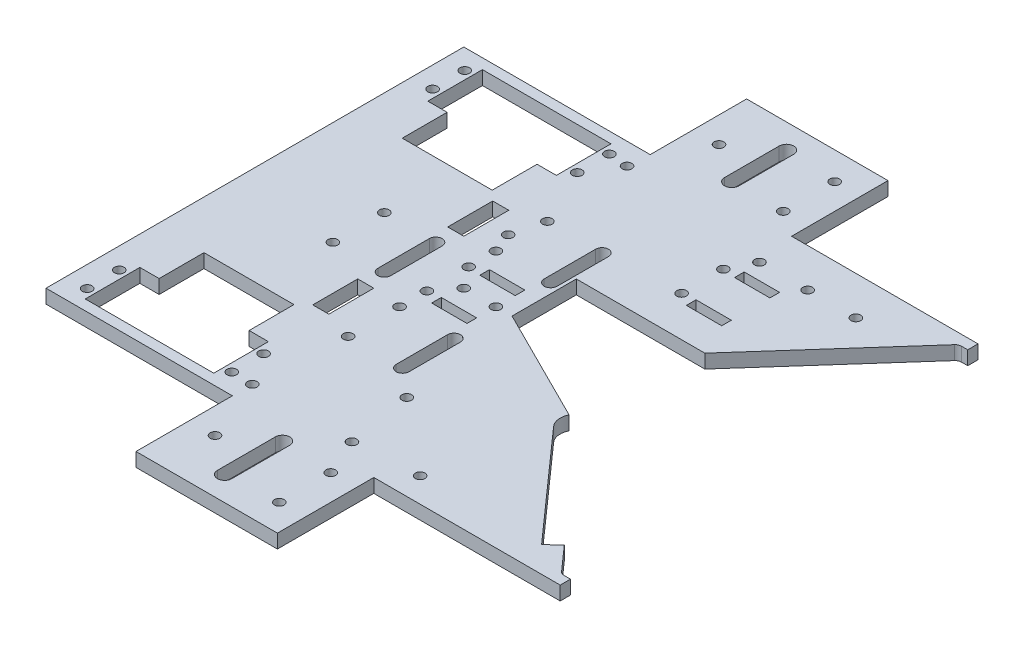
from build123d import *

# Parameters (mm, degrees)
BOSS_EXTRUDE1_DEPTH = 4.3
CUT_EXTRUDE1_DEPTH  = 4.5
FILLET1_R           = 2
CUT_EXTRUDE2_DEPTH  = 10
SKETCH8_R           = 1.5
CUT_EXTRUDE3_DEPTH  = 10
SKETCH9_R           = 1.5
CUT_EXTRUDE4_DEPTH  = 10
CUT_EXTRUDE5_DEPTH  = 10
SKETCH11_R          = 1.5
CUT_EXTRUDE6_DEPTH  = 10
SKETCH12_R          = 1.5
CUT_EXTRUDE7_DEPTH  = 10
SKETCH7_R           = 1.5
SKETCH7_W           = 11
SKETCH7_H           = 3
CUT_EXTRUDE8_DEPTH  = 9
SKETCH13_R          = 1.5
CUT_EXTRUDE9_DEPTH  = 10
SKETCH14_R          = 1.5
CUT_EXTRUDE10_DEPTH = 10
SKETCH15_W          = 5
SKETCH15_H          = 14
CUT_EXTRUDE11_DEPTH = 10
SKETCH16_R          = 1.5
CUT_EXTRUDE12_DEPTH = 10
SKETCH18_R          = 1.5
CUT_EXTRUDE13_DEPTH = 10


with BuildPart() as part:
    # Sketch2 → Boss-Extrude1 (new body)
    with BuildSketch(Plane(origin=(0, 0, 0), x_dir=(1, 0, 0), z_dir=(0, 1, 0))):
        Polygon((0, 0), (0, 65), (58, 65), (58, 95), (102, 95), (102, 65), (160, 65), (160, 0), align=None)
    extrude(amount=BOSS_EXTRUDE1_DEPTH)

    # Mirror1: part across plane


with BuildPart() as part_1:
    add(part.part)
    add(part.part.mirror(Plane(origin=(0, 4.3, 0), x_dir=(1, 0, 0), z_dir=(0, 0, -1))))

    # Sketch3 → Cut-Extrude1 (cut)
    with BuildSketch(Plane(origin=(0, 4.3, 0), x_dir=(1, 0, 0), z_dir=(0, 1, 0))):
        Polygon((160, -61.8), (160, 61.8), (157.156451185, 61.8), (120.012594795, 20), (80.012594795, 20), (80.012594795, 0), (120, -20), (157.155555556, -61.8), align=None)
    extrude(amount=-CUT_EXTRUDE1_DEPTH, mode=Mode.SUBTRACT)

    # Fillet1
    fillet1_edges = [part_1.edges().sort_by_distance(p)[0] for p in [
        (157.156451185, 2.15, -61.8),
        (157.155555556, 2.15, 61.8),
    ]]
    fillet(fillet1_edges, radius=FILLET1_R)

    # Sketch6 → Cut-Extrude2 (cut)
    with BuildSketch(Plane(origin=(0, 4.3, 0), x_dir=(1, 0, 0), z_dir=(0, 1, 0))):
        Polygon((9, -61.8), (49, -61.8), (49, -44.8), (43, -44.8), (43, -30.841820122), (15, -30.841820122), (15, -44.8), (9, -44.8), align=None)
        Polygon((9, 44.8), (15, 44.8), (15, 30.841820122), (43, 30.841820122), (43, 44.8), (49, 44.8), (49, 61.8), (9, 61.8), align=None)
    extrude(amount=-CUT_EXTRUDE2_DEPTH, mode=Mode.SUBTRACT)

    # Sketch8 → Cut-Extrude3 (cut)
    with BuildSketch(Plane(origin=(0, 4.3, 0), x_dir=(1, 0, 0), z_dir=(0, 1, 0))):
        with Locations((6.5, 58.8)):
            Circle(SKETCH8_R)
        with Locations((6.5, 48.8)):
            Circle(SKETCH8_R)
        with Locations((51.5, 48.8)):
            Circle(SKETCH8_R)
        with Locations((51.5, 58.8)):
            Circle(SKETCH8_R)
        with Locations((6.5, -48.7)):
            Circle(SKETCH8_R)
        with Locations((6.5, -58.7)):
            Circle(SKETCH8_R)
        with Locations((51.5, -58.7)):
            Circle(SKETCH8_R)
        with Locations((51.5, -48.8)):
            Circle(SKETCH8_R)
    extrude(amount=-CUT_EXTRUDE3_DEPTH, mode=Mode.SUBTRACT)

    # Sketch9 → Cut-Extrude4 (cut)
    with BuildSketch(Plane.XZ):
        with Locations((94, 70.4)):
            Circle(SKETCH9_R)
        with Locations((66, 78.4)):
            Circle(SKETCH9_R)
        with Locations((66, -78.4)):
            Circle(SKETCH9_R)
        with Locations((94, -86.4)):
            Circle(SKETCH9_R)
        with Locations((94, 86.4)):
            Circle(SKETCH9_R)
        with Locations((94, -70.4)):
            Circle(SKETCH9_R)
        with BuildLine():
            Line((75.75, 69.4), (75.75, 87.4))
            ThreePointArc((75.75, 87.4), (78, 89.65), (80.25, 87.4))
            Line((80.25, 87.4), (80.25, 69.4))
            ThreePointArc((80.25, 69.4), (78, 67.15), (75.75, 69.4))
        make_face()
        with BuildLine():
            Line((75.75, -87.4), (75.75, -70.4))
            ThreePointArc((75.75, -70.4), (78, -68.15), (80.25, -70.4))
            Line((80.25, -70.4), (80.25, -87.4))
            ThreePointArc((80.25, -87.4), (78, -89.65), (75.75, -87.4))
        make_face()
    extrude(amount=-CUT_EXTRUDE4_DEPTH, mode=Mode.SUBTRACT)

    # Sketch10 → Cut-Extrude5 (cut)
    with BuildSketch(Plane(origin=(0, 4.3, 0), x_dir=(1, 0, 0), z_dir=(0, 1, 0))):
        with BuildLine():
            Line((123.321819194, -23.737046593), (149.896372747, -53.633419341))
            Line((149.896372747, -53.633419341), (146.159326154, -56.955238535))
            Line((146.159326154, -56.955238535), (116.262953407, -23.321819194))
            ThreePointArc((116.262953407, -23.321819194), (120.29361011, -15.008628134), (123.321819194, -23.737046593))
        make_face()
    extrude(amount=-CUT_EXTRUDE5_DEPTH, mode=Mode.SUBTRACT)

    # Sketch11 → Cut-Extrude6 (cut)
    with BuildSketch(Plane.XZ):
        with BuildLine():
            ThreePointArc((79, 31.031280577), (77, 33.031280577), (75, 31.031280577))
            Line((75, 31.031280577), (75, 15.031280577))
            ThreePointArc((75, 15.031280577), (77, 13.031280577), (79, 15.031280577))
            Line((79, 15.031280577), (79, 31.031280577))
        make_face()
        with BuildLine():
            ThreePointArc((75, -31.031280577), (77, -33.031280577), (79, -31.031280577))
            Line((79, -31.031280577), (79, -15.031280577))
            ThreePointArc((79, -15.031280577), (77, -13.031280577), (75, -15.031280577))
            Line((75, -15.031280577), (75, -31.031280577))
        make_face()
        with Locations((60, 31)):
            Circle(SKETCH11_R)
        with Locations((60, 15)):
            Circle(SKETCH11_R)
        with Locations((60, -15)):
            Circle(SKETCH11_R)
        with Locations((60, -31)):
            Circle(SKETCH11_R)
    extrude(amount=-CUT_EXTRUDE6_DEPTH, mode=Mode.SUBTRACT)

    # Sketch12 → Cut-Extrude7 (cut)
    with BuildSketch(Plane(origin=(0, 0, 0), x_dir=(-1, 0, 0), z_dir=(0, -1, 0))):
        with BuildLine():
            ThreePointArc((-50.262723036, -8), (-48.262723036, -10), (-46.262723036, -8))
            Line((-46.262723036, -8), (-46.262723036, 8))
            ThreePointArc((-46.262723036, 8), (-48.262723036, 10), (-50.262723036, 8))
            Line((-50.262723036, 8), (-50.262723036, -8))
        make_face()
        with Locations((-32.262723036, -8)):
            Circle(SKETCH12_R)
        with Locations((-32.262723036, 8)):
            Circle(SKETCH12_R)
    extrude(amount=-CUT_EXTRUDE7_DEPTH, mode=Mode.SUBTRACT)

    # Sketch7 → Cut-Extrude8 (cut)
    with BuildSketch(Plane(origin=(0, 4.3, 0), x_dir=(1, 0, 0), z_dir=(0, 1, 0))):
        with Locations((60.012594795, -6.5)):
            Circle(SKETCH7_R)
        with Locations((60.012594795, 6.5)):
            Circle(SKETCH7_R)
        with Locations((100.267282946, 32.5)):
            Circle(SKETCH7_R)
        with Locations((100.267282946, 45.5)):
            Circle(SKETCH7_R)
        with Locations((69.5, -7.5)):
            Rectangle(SKETCH7_W, SKETCH7_H)
        with Locations((69.5, 7.5)):
            Rectangle(SKETCH7_W, SKETCH7_H)
        with Locations((109.754688151, 31.5)):
            Rectangle(SKETCH7_W, SKETCH7_H)
        with Locations((109.754688151, 46.5)):
            Rectangle(SKETCH7_W, SKETCH7_H)
    extrude(amount=-CUT_EXTRUDE8_DEPTH, mode=Mode.SUBTRACT)

    # Sketch13 → Cut-Extrude9 (cut)
    with BuildSketch(Plane(origin=(0, 4.3, 0), x_dir=(1, 0, 0), z_dir=(0, 1, 0))):
        with Locations((75, 0)):
            Circle(SKETCH13_R)
        with Locations((65, 0)):
            Circle(SKETCH13_R)
    extrude(amount=-CUT_EXTRUDE9_DEPTH, mode=Mode.SUBTRACT)

    # Sketch14 → Cut-Extrude10 (cut)
    with BuildSketch(Plane(origin=(0, 4.3, 0), x_dir=(1, 0, 0), z_dir=(0, 1, 0))):
        with Locations((57.5, 58.3)):
            Circle(SKETCH14_R)
        with Locations((57.5, 21.3)):
            Circle(SKETCH14_R)
        with Locations((85.565271793, -38.309819587)):
            Circle(SKETCH14_R)
        with Locations((108.754116531, -57.343407785)):
            Circle(SKETCH14_R)
    extrude(amount=-CUT_EXTRUDE10_DEPTH, mode=Mode.SUBTRACT)

    # Sketch15 → Cut-Extrude11 (cut)
    with BuildSketch(Plane(origin=(0, 4.3, 0), x_dir=(1, 0, 0), z_dir=(0, 1, 0))):
        with Locations((48.5, 21)):
            Rectangle(SKETCH15_W, SKETCH15_H)
        with Locations((48.5, -21)):
            Rectangle(SKETCH15_W, SKETCH15_H)
    extrude(amount=-CUT_EXTRUDE11_DEPTH, mode=Mode.SUBTRACT)

    # Sketch16 → Cut-Extrude12 (cut)
    with BuildSketch(Plane(origin=(0, 4.3, 0), x_dir=(1, 0, 0), z_dir=(0, 1, 0))):
        with Locations((89, -58.8)):
            Circle(SKETCH16_R)
        with Locations((58, -58.8)):
            Circle(SKETCH16_R)
    extrude(amount=-CUT_EXTRUDE12_DEPTH, mode=Mode.SUBTRACT)

    # Sketch18 → Cut-Extrude13 (cut)
    with BuildSketch(Plane(origin=(0, 4.3, 0), x_dir=(1, 0, 0), z_dir=(0, 1, 0))):
        with Locations((104, 53)):
            Circle(SKETCH18_R)
        with Locations((119, 53)):
            Circle(SKETCH18_R)
        with Locations((134, 53)):
            Circle(SKETCH18_R)
    extrude(amount=-CUT_EXTRUDE13_DEPTH, mode=Mode.SUBTRACT)


solid = part_1.part
